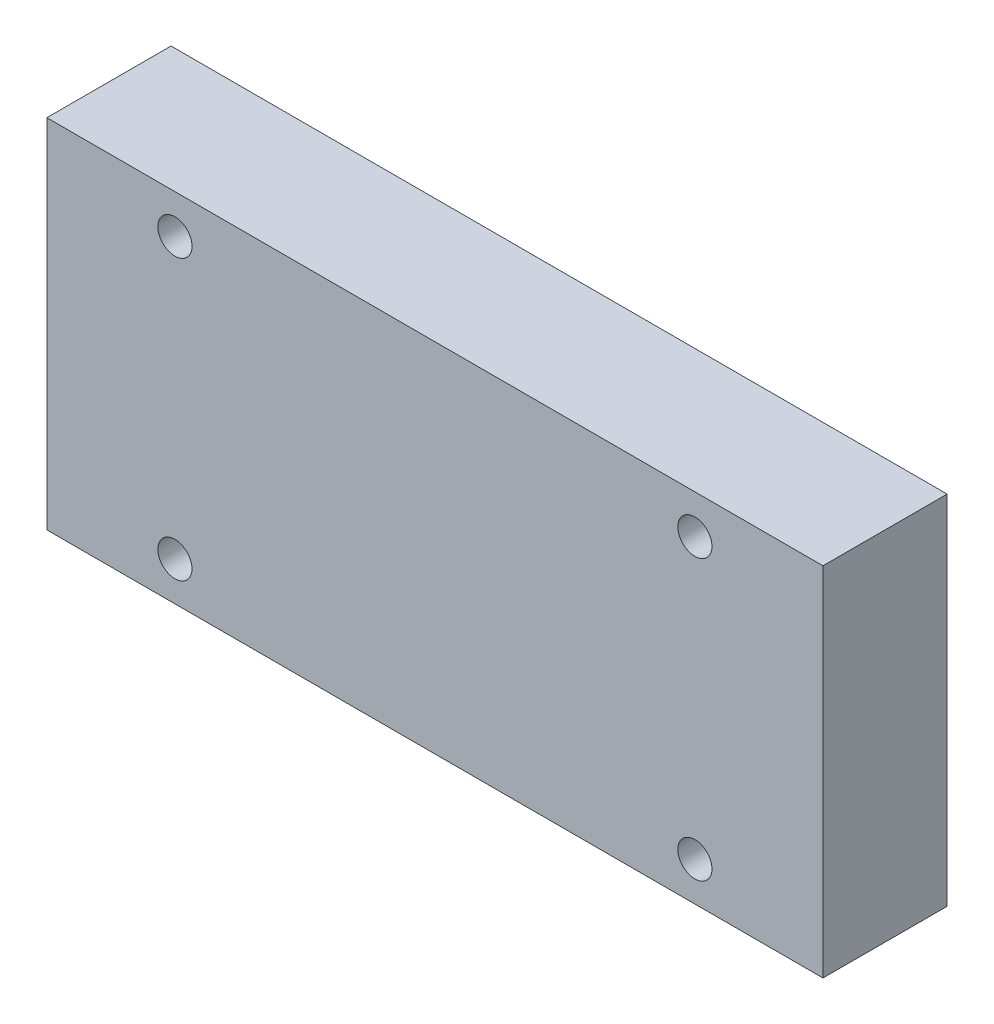
from build123d import *

# Parameters (mm, degrees)
SKETCH1_W           = 50
SKETCH1_H           = 23
SKETCH1_R           = 1.1
BOSS_EXTRUDE1_DEPTH = 8


with BuildPart() as part:
    # Sketch1 → Boss-Extrude1 (new body)
    with BuildSketch(Plane.XY):
        Rectangle(SKETCH1_W, SKETCH1_H)
        with Locations((-16.75, 9)):
            Circle(SKETCH1_R, mode=Mode.SUBTRACT)
        with Locations((16.75, 9)):
            Circle(SKETCH1_R, mode=Mode.SUBTRACT)
        with Locations((-16.75, -9)):
            Circle(SKETCH1_R, mode=Mode.SUBTRACT)
        with Locations((16.75, -9)):
            Circle(SKETCH1_R, mode=Mode.SUBTRACT)
    extrude(amount=BOSS_EXTRUDE1_DEPTH)


solid = part.part
